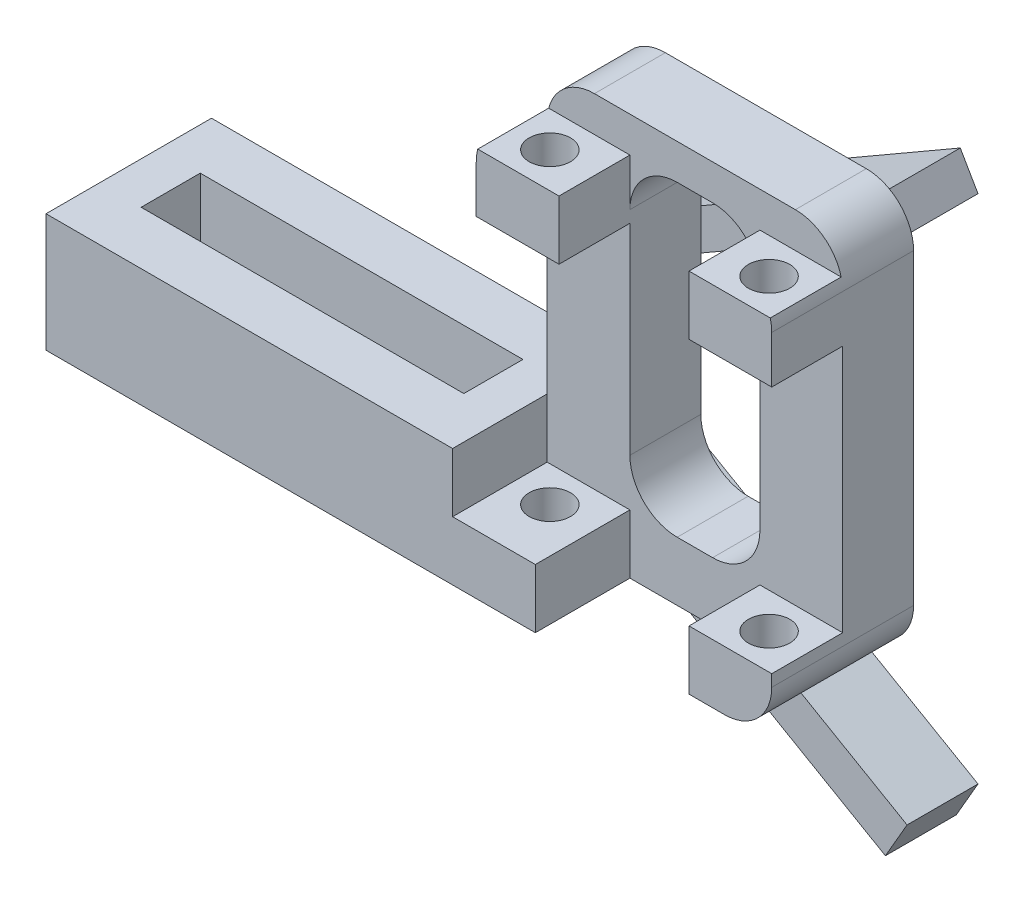
from build123d import *

# Parameters (mm, degrees)
CROQUIS1_W              = 25
CROQUIS1_H              = 34
SALIENTE_EXTRUIR1_DEPTH = 6
CROQUIS2_W              = 7
CROQUIS2_H              = 5
SALIENTE_EXTRUIR2_DEPTH = 6
CORTAR_EXTRUIR1_REACH   = 44.626
CROQUIS3_W              = 11
CROQUIS3_H              = 26
REDONDEO1_R             = 4
SALIENTE_EXTRUIR3_DEPTH = 12
SALIENTE_EXTRUIR4_DEPTH = 2
CORTAR_EXTRUIR2_REACH   = 70.45
CROQUIS7_R              = 1.75
CORTAR_EXTRUIR3_REACH   = 67.577
CROQUIS8_W              = 27.3
CROQUIS8_H              = 5
SALIENTE_EXTRUIR5_DEPTH = 6


with BuildPart() as part:
    # Croquis1 → Saliente-Extruir1 (new body)
    with BuildSketch(Plane.XY):
        with Locations((-12.5, -17)):
            Rectangle(CROQUIS1_W, CROQUIS1_H)
    extrude(amount=SALIENTE_EXTRUIR1_DEPTH)

    # Croquis2 → Saliente-Extruir2 (add)
    with BuildSketch(Plane.XY.offset(6)):
        with Locations((-21.5, -5.5)):
            Rectangle(CROQUIS2_W, CROQUIS2_H)
        with Locations((-3.5, -5.5)):
            Rectangle(CROQUIS2_W, CROQUIS2_H)
        with Locations((-3.5, -31.5)):
            Rectangle(CROQUIS2_W, CROQUIS2_H)
        with Locations((-21.5, -31.5)):
            Rectangle(CROQUIS2_W, CROQUIS2_H)
    extrude(amount=SALIENTE_EXTRUIR2_DEPTH)

    # Croquis3 → Cortar-Extruir1 (cut, up to next)
    with BuildSketch(Plane.XY.offset(6), mode=Mode.PRIVATE) as cortar_extruir1_sk1:
        with Locations((-12.5, -16)):
            Rectangle(CROQUIS3_W, CROQUIS3_H)
    cortar_extruir1_tool1 = extrude(cortar_extruir1_sk1.sketch, amount=-CORTAR_EXTRUIR1_REACH, mode=Mode.PRIVATE) & part.part
    add(cortar_extruir1_tool1.solids().sort_by_distance((-12.5, -16, 6))[0], mode=Mode.SUBTRACT)

    # Redondeo1
    # the kernel refuses this fillet: 4 mm, written as the material it adds along each edge
    with BuildSketch(Plane(origin=(-18, -29, 6), x_dir=(0, 1, 0), z_dir=(0, 0, -1)), Plane(origin=(-7, -29, 6), x_dir=(-1, 0, 0), z_dir=(0, 0, -1)), Plane(origin=(-18, -3, 6), x_dir=(1, 0, 0), z_dir=(0, 0, -1))) as redondeo1_piece_1:
        with BuildLine():
            CenterArc((REDONDEO1_R, REDONDEO1_R), REDONDEO1_R, 180, 90)
            Line((0, REDONDEO1_R), (0, 0))
            Line((0, 0), (REDONDEO1_R, 0))
        make_face()
    extrude(amount=6)
    with BuildSketch(Plane(origin=(-7, -3, 6), x_dir=(-1, 0, 0), z_dir=(0, 0, -1))) as redondeo1_piece_2:
        with BuildLine():
            CenterArc((REDONDEO1_R, -REDONDEO1_R), REDONDEO1_R, 90, 90)
            Line((0, -REDONDEO1_R), (0, 0))
            Line((0, 0), (REDONDEO1_R, 0))
        make_face()
    extrude(amount=6)
    # the kernel refuses this fillet: 4 mm, written as the material it takes off along each edge
    with BuildSketch(Plane(origin=(0, 0, -10), x_dir=(-1, 0, 0), z_dir=(0, 0, 1))) as redondeo1_2_piece_1:
        with BuildLine():
            CenterArc((REDONDEO1_R, REDONDEO1_R), REDONDEO1_R, 180, 90)
            Line((0, REDONDEO1_R), (0, 0))
            Line((0, 0), (REDONDEO1_R, 0))
        make_face()
    extrude(amount=26, mode=Mode.SUBTRACT)
    with BuildSketch(Plane(origin=(0, -34, 22), x_dir=(0, 1, 0), z_dir=(0, 0, -1)), Plane(origin=(-25, -34, -10), x_dir=(0, 1, 0), z_dir=(0, 0, 1))) as redondeo1_2_piece_2:
        with BuildLine():
            CenterArc((REDONDEO1_R, -REDONDEO1_R), REDONDEO1_R, 90, 90)
            Line((0, -REDONDEO1_R), (0, 0))
            Line((0, 0), (REDONDEO1_R, 0))
        make_face()
    extrude(amount=32, mode=Mode.SUBTRACT)
    with BuildSketch(Plane(origin=(-25, 0, -10), x_dir=(1, 0, 0), z_dir=(0, 0, 1))) as redondeo1_2_piece_3:
        with BuildLine():
            CenterArc((REDONDEO1_R, -REDONDEO1_R), REDONDEO1_R, 90, 90)
            Line((0, -REDONDEO1_R), (0, 0))
            Line((0, 0), (REDONDEO1_R, 0))
        make_face()
    extrude(amount=26, mode=Mode.SUBTRACT)

    # Croquis5 → Saliente-Extruir3 (add)
    with BuildSketch(Plane(origin=(0, 0, 0), x_dir=(-1, 0, 0), z_dir=(0, 0, -1))):
        with BuildLine():
            Line((25, -29), (25, -30))
            ThreePointArc((25, -30), (23.828427125, -32.828427125), (21, -34))
            Line((21, -34), (25, -34))
            Line((25, -34), (59.4, -34))
            Line((59.4, -34), (59.4, -24))
            Line((59.4, -24), (25, -24))
            Line((25, -24), (25, -29))
        make_face()
    extrude(amount=-SALIENTE_EXTRUIR3_DEPTH)

    # Croquis6 → Saliente-Extruir4 (add)
    with BuildSketch(Plane.XY.offset(12)):
        Polygon((-18, -29), (-25, -29), (-25, -24), (-59.4, -24), (-59.4, -34), (-18, -34), align=None)
    extrude(amount=SALIENTE_EXTRUIR4_DEPTH)

    # Cortar-Extruir2: up to this face of the body (flat: up to its plane)
    cortar_extruir2_end = Plane(part.part.faces().sort_by_distance((-34.409507042, -34, 6.559859155))[0])
    # Croquis7 → Cortar-Extruir2 (cut, up to the picked face)
    with BuildSketch(Plane(origin=(0, -3, 0), x_dir=(1, 0, 0), z_dir=(0, 1, 0)), mode=Mode.PRIVATE) as cortar_extruir2_sk1:
        with Locations(Location((-21.772983346, -9, 0), (0, 0, 270))):
            Circle(CROQUIS7_R)
    cortar_extruir2_tool1 = split(extrude(cortar_extruir2_sk1.sketch, amount=-CORTAR_EXTRUIR2_REACH, mode=Mode.PRIVATE), bisect_by=cortar_extruir2_end, keep=Keep.BOTH, mode=Mode.PRIVATE)
    # Croquis7 → Cortar-Extruir2 (cut, up to the picked face)
    with BuildSketch(Plane(origin=(0, -3, 0), x_dir=(1, 0, 0), z_dir=(0, 1, 0)), mode=Mode.PRIVATE) as cortar_extruir2_sk2:
        with Locations(Location((-3.227016654, -9, 0), (0, 0, 243.787297197))):
            Circle(CROQUIS7_R)
    cortar_extruir2_tool2 = split(extrude(cortar_extruir2_sk2.sketch, amount=-CORTAR_EXTRUIR2_REACH, mode=Mode.PRIVATE), bisect_by=cortar_extruir2_end, keep=Keep.BOTH, mode=Mode.PRIVATE)
    add(cortar_extruir2_tool1.solids().sort_by(Axis((-21.772983, -3, 9), (0, -1, 0)))[0], mode=Mode.SUBTRACT)
    add(cortar_extruir2_tool2.solids().sort_by(Axis((-3.227017, -3, 9), (0, -1, 0)))[0], mode=Mode.SUBTRACT)

    # Croquis8 → Cortar-Extruir3 (cut, up to next)
    with BuildSketch(Plane(origin=(0, -24, 0), x_dir=(1, 0, 0), z_dir=(0, 1, 0)), mode=Mode.PRIVATE) as cortar_extruir3_sk1:
        with Locations((-42.2, -7)):
            Rectangle(CROQUIS8_W, CROQUIS8_H)
    cortar_extruir3_tool1 = extrude(cortar_extruir3_sk1.sketch, amount=-CORTAR_EXTRUIR3_REACH, mode=Mode.PRIVATE) & part.part
    add(cortar_extruir3_tool1.solids().sort_by_distance((-42.2, -24, 7))[0], mode=Mode.SUBTRACT)

    # Croquis9 → Saliente-Extruir5 (add)
    with BuildSketch(Plane(origin=(0, 0, 0), x_dir=(-1, 0, 0), z_dir=(0, 0, -1))):
        Polygon((2.0503268, -0.507325607), (25, -13.757325607), (23.5, -16.355401819), (17.437822174, -12.855401819), (6.612504626, -6.605401819), (0.5503268, -3.105401819), align=None)
        Polygon((25.33358423, -36.281262865), (2.38391103, -49.531262865), (0.5503268, -46.355401819), (6.612504626, -42.855401819), (17.437822174, -36.605401819), (23.5, -33.105401819), align=None)
    extrude(amount=SALIENTE_EXTRUIR5_DEPTH)


solid = part.part
